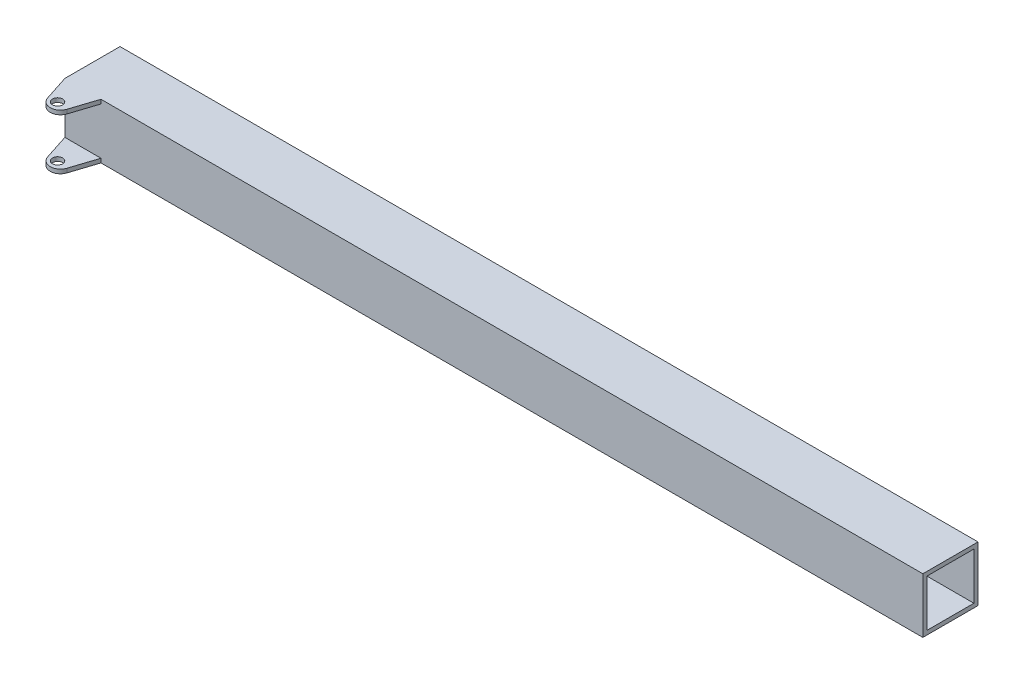
from build123d import *

# Parameters (mm, degrees)
SKETCH1_W           = 270
SKETCH1_H           = 270
SKETCH1_W_2         = 230
SKETCH1_H_2         = 230
BOSS_EXTRUDE1_DEPTH = 4200
BOSS_EXTRUDE2_REACH = 4212.834
SKETCH2_R           = 25
SKETCH3_R           = 25
BOSS_EXTRUDE3_DEPTH = 20


with BuildPart() as part:
    # Sketch1 → Boss-Extrude1 (new body)
    with BuildSketch(Plane(origin=(0, 0, 0), x_dir=(0, 0, -1), z_dir=(1, 0, 0))):
        with Locations((0, 135)):
            Rectangle(SKETCH1_W, SKETCH1_H)
        with Locations((0, 135)):
            Rectangle(SKETCH1_W_2, SKETCH1_H_2, mode=Mode.SUBTRACT)
    extrude(amount=-BOSS_EXTRUDE1_DEPTH)

    # Sketch2 → Boss-Extrude2 (add, up to next)
    with BuildSketch(Plane.XZ, mode=Mode.PRIVATE) as boss_extrude2_sk1:
        with Locations((-200, 0)):
            Circle(SKETCH2_R)
    boss_extrude2_tool1 = extrude(boss_extrude2_sk1.sketch, amount=-BOSS_EXTRUDE2_REACH, mode=Mode.PRIVATE) - part.part
    add(boss_extrude2_tool1.solids().sort_by_distance((-200, 0, 0))[0])

    # Sketch3 → Boss-Extrude3 (add)
    with BuildSketch(Plane(origin=(0, 0, 0), x_dir=(1, 0, 0), z_dir=(0, 1, 0))):
        with BuildLine():
            Line((-4023.2452538, -135), (-4064.076833276, -260.472475841))
            ThreePointArc((-4064.076833276, -260.472475841), (-4111.6226269, -295), (-4159.168420524, -260.472475841))
            Line((-4159.168420524, -260.472475841), (-4200, -135))
            Line((-4200, -135), (-4023.2452538, -135))
        make_face()
        with Locations((-4118.216527145, -252.56)):
            Circle(SKETCH3_R, mode=Mode.SUBTRACT)
    boss_extrude3 = extrude(amount=BOSS_EXTRUDE3_DEPTH)

    # Mirror1: Boss-Extrude3 across plane
    add(boss_extrude3.mirror(Plane(origin=(0, 135, 0), x_dir=(0, 0, 1), z_dir=(0, -1, 0))))


solid = part.part
